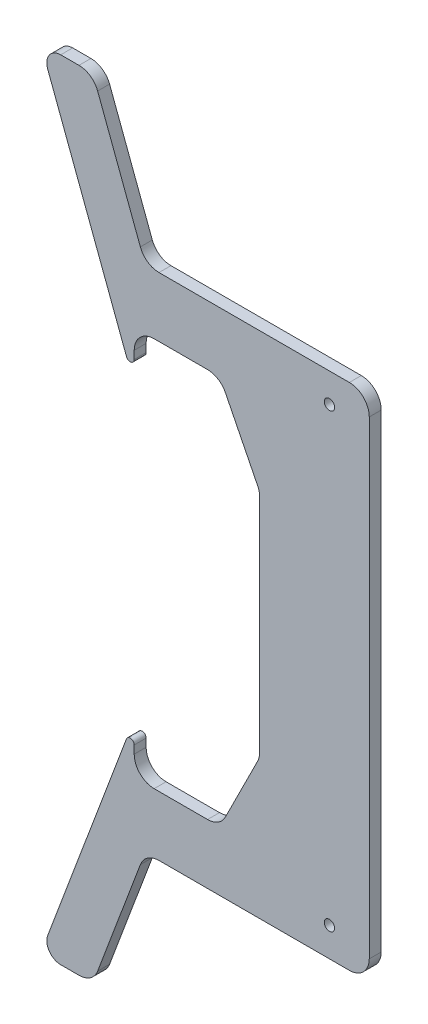
from build123d import *

# Parameters (mm, degrees)
ESBO_O1_R                = 2.6
RESSALTO_EXTRUS_O1_DEPTH = 6
FILETE1_R                = 2
FILETE3_R                = 10
FILETE4_R                = 7


with BuildPart() as part:
    # Esboço1 → Ressalto-extrusão1 (new body)
    with BuildSketch(Plane.XY):
        Polygon((-98, 97.8), (-55, 97.8), (-35, 57.8), (-35, -57.8), (-55, -97.8), (-98, -97.8), (-98, -72.8), (-145, -197.8), (-118.8, -197.8), (-92.48, -127.8), (20, -127.8), (20, 127.8), (-92.48, 127.8), (-118.8, 197.8), (-145, 197.8), (-98, 72.8), align=None)
        with Locations((0, 113.2)):
            Circle(ESBO_O1_R, mode=Mode.SUBTRACT)
        with Locations((0, -113.2)):
            Circle(ESBO_O1_R, mode=Mode.SUBTRACT)
    extrude(amount=RESSALTO_EXTRUS_O1_DEPTH)

    # Filete1
    filete1_edges = [part.edges().sort_by_distance(p)[0] for p in [
        (-98, -72.8, 3),
        (-98, 72.8, 3),
    ]]
    fillet(filete1_edges, radius=FILETE1_R)

    # Filete3
    filete3_edges = [part.edges().sort_by_distance(p)[0] for p in [
        (-92.48, -127.8, 3),
        (-118.8, -197.8, 3),
        (-98, -97.8, 3),
        (20, -127.8, 3),
        (20, 127.8, 3),
        (-98, 97.8, 3),
        (-92.48, 127.8, 3),
        (-118.8, 197.8, 3),
        (-55, -97.8, 3),
        (-55, 97.8, 3),
        (-35, -57.8, 3),
        (-35, 57.8, 3),
    ]]
    fillet(filete3_edges, radius=FILETE3_R)

    # Filete4
    filete4_edges = [part.edges().sort_by_distance(p)[0] for p in [
        (-145, 197.8, 3),
        (-145, -197.8, 3),
    ]]
    fillet(filete4_edges, radius=FILETE4_R)


solid = part.part
